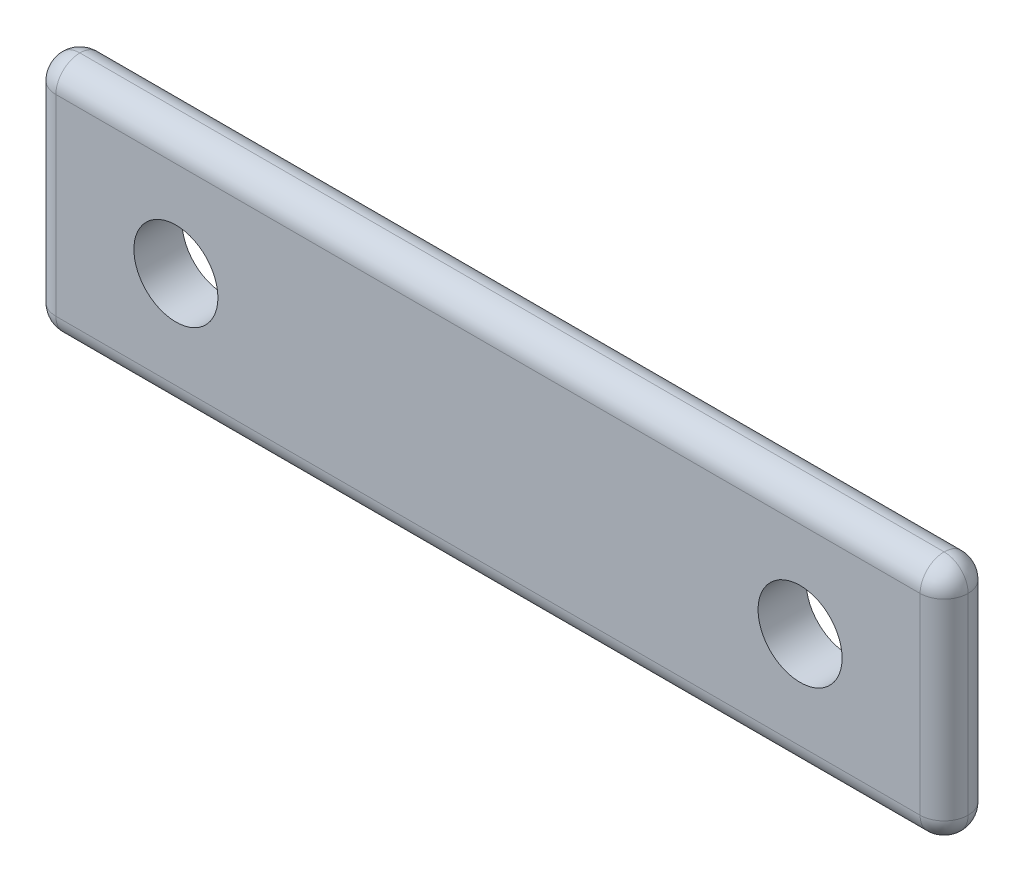
from build123d import *

# Parameters (mm, degrees)
ESBO_O1_W                                = 190
ESBO_O1_H                                = 50
RESSALTO_EXTRUS_O1_DEPTH                 = 10
FILETE1_R                                = 5
BROCA_DE_ROSQUEAR_PARA_TARRAXA_DE_M201_D = 17.5


with BuildPart() as part:
    # Esboço1 → Ressalto-extrusão1 (new body)
    with BuildSketch(Plane.XY):
        with Locations((95, 25)):
            Rectangle(ESBO_O1_W, ESBO_O1_H)
    extrude(amount=RESSALTO_EXTRUS_O1_DEPTH)

    # Filete1
    filete1_edges = [part.edges().sort_by_distance(p)[0] for p in [
        (95, 50, 10),
        (0, 25, 10),
        (95, 0, 10),
        (0, 25, 0),
        (95, 50, 0),
        (190, 25, 0),
        (95, 0, 0),
        (0, 0, 5),
        (0, 50, 5),
        (190, 50, 5),
        (190, 0, 5),
        (190, 25, 10),
    ]]
    fillet(filete1_edges, radius=FILETE1_R - 0.0001)  # a hair under: the kernel refuses the full size

    # Broca de rosquear para tarraxa de M201 (through all)
    with Locations(Plane.XY.offset(10)):
        with Locations((30, 25.206865572), (160, 25.206865572)):
            Hole(BROCA_DE_ROSQUEAR_PARA_TARRAXA_DE_M201_D / 2)


solid = part.part
